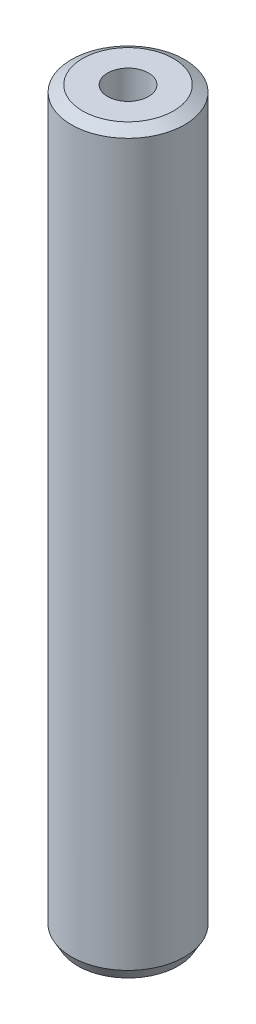
from build123d import *
from OCP.BRepFilletAPI import BRepFilletAPI_MakeChamfer

# Parameters (mm, degrees)
SKETCH1_R           = 7.5
BOSS_EXTRUDE1_DEPTH = 97.837483226
SKETCH2_R           = 2.71076184
CUT_EXTRUDE1_DEPTH  = 99.410736833
CHAMFER1_SIZE       = 0.850454853
CHAMFER1_SIZE2      = 1.473031016


with BuildPart() as part:
    # Sketch1 → Boss-Extrude1 (new body)
    with BuildSketch(Plane(origin=(0, 0, 0), x_dir=(1, 0, 0), z_dir=(0, 1, 0))):
        Circle(SKETCH1_R)
    extrude(amount=BOSS_EXTRUDE1_DEPTH)

    # Sketch2 → Cut-Extrude1 (cut, through all)
    with BuildSketch(Plane(origin=(0, 0, 0), x_dir=(1, 0, 0), z_dir=(0, 1, 0))):
        Circle(SKETCH2_R)
    extrude(amount=CUT_EXTRUDE1_DEPTH, mode=Mode.SUBTRACT)

    # Chamfer1: one chamfer whose edges measure the first distance from different faces: ONE call of the kernel's chamfer builder (chamfer() names one face for all edges)
    chamfer1_edges_1 = [part.edges().sort_by_distance(p)[0] for p in [
        (-7.5, 97.837483226, 0),
    ]]
    chamfer1_side_1 = [part.faces().sort_by_distance(p)[0] for p in [
        (-7.5, 48.918741613, 0),
    ]]
    chamfer1_edges_2 = [part.edges().sort_by_distance(p)[0] for p in [
        (-7.5, 0, 0),
    ]]
    chamfer1_side_2 = [part.faces().sort_by_distance(p)[0] for p in [
        (-7.287867966, 0, 0),
    ]]
    chamfer1 = BRepFilletAPI_MakeChamfer(part.part.solid().wrapped)
    for e in chamfer1_edges_1:
        chamfer1.Add(CHAMFER1_SIZE, CHAMFER1_SIZE2, e.wrapped, chamfer1_side_1[0].wrapped)  # the first distance lies on this face
    for e in chamfer1_edges_2:
        chamfer1.Add(CHAMFER1_SIZE, CHAMFER1_SIZE2, e.wrapped, chamfer1_side_2[0].wrapped)  # the first distance lies on this face
    add(Compound.cast(chamfer1.Shape()), mode=Mode.REPLACE)


solid = part.part
